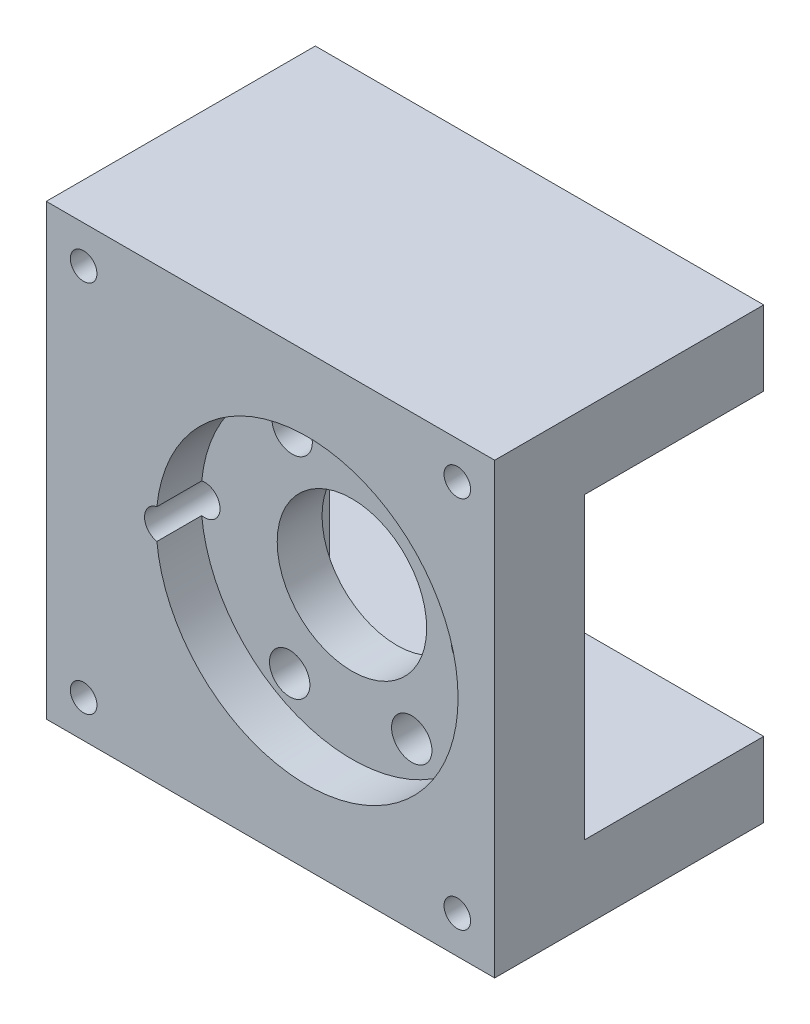
from build123d import *

# Parameters (mm, degrees)
SKETCH2_W              = 30
SKETCH2_H              = 30
SKETCH2_R              = 5
SKETCH2_R_2            = 1.025
BOSS_EXTRUDE1_DEPTH    = 18
SKETCH3_W              = 30
SKETCH3_H              = 20
CUT_EXTRUDE1_DEPTH     = 9
F_2_56_TAPPED_HOLE1_D  = 1.778
CUT_EXTRUDE2_START     = -3
SKETCH8_R              = 10.1
SKETCH8_R_2            = 5
SKETCH8_R_3            = 1.025
CUT_EXTRUDE2_DEPTH     = 3
BOSS_EXTRUDE2_START    = 0.4
SKETCH9_R              = 2
SKETCH9_R_2            = 1.025
BOSS_EXTRUDE2_DEPTH    = 0.4
SKETCH10_W             = 20.050000056
SKETCH10_H             = 20
CUT_EXTRUDE3_DEPTH     = 2.999999892
FILLET1_START          = 9
FILLET1_DEPTH          = 4
M2_5_CLEARANCE_HOLE1_D = 2.7


with BuildPart() as part:
    # Sketch2 → Boss-Extrude1 (new body)
    # profile 1 of 2: a face of its own
    with BuildSketch(Plane.XY):
        with Locations((15, 0)):
            Rectangle(SKETCH2_W, SKETCH2_H)
        with Locations((17.449999944, 0)):
            Circle(SKETCH2_R, mode=Mode.SUBTRACT)
        with Locations((7.599999986, 0)):
            Circle(SKETCH2_R_2, mode=Mode.SUBTRACT)
    # profile 2 of 2: a face of its own
    with BuildSketch(Plane.XY):
        with BuildLine():
            ThreePointArc((22.449999944, 0), (20.98553385, -3.535533906), (17.449999944, -5))
            Line((17.449999944, -5), (30, -5))
            Line((30, -5), (30, 5))
            Line((30, 5), (17.449999944, 5))
            ThreePointArc((17.449999944, 5), (20.98553385, 3.535533906), (22.449999944, 0))
        make_face()
    extrude(amount=BOSS_EXTRUDE1_DEPTH)

    # Sketch3 → Cut-Extrude1 (cut)
    with BuildSketch(Plane(origin=(0, 0, 0), x_dir=(-1, 0, 0), z_dir=(0, 0, -1))):
        with Locations((-15, 0)):
            Rectangle(SKETCH3_W, SKETCH3_H)
    extrude(amount=-CUT_EXTRUDE1_DEPTH, mode=Mode.SUBTRACT)

    # #2-56 Tapped Hole1 (through all)
    with Locations(Plane(origin=(0, 0, 0), x_dir=(-1, 0, 0), z_dir=(0, 0, -1))):
        with Locations((-27.5, 12.5), (-27.5, -12.5), (-2.5, -12.5), (-2.5, 12.5)):
            Hole(F_2_56_TAPPED_HOLE1_D / 2)

    # Sketch8 → Cut-Extrude2 (cut)
    # profile 1 of 2: a face of its own
    with BuildSketch(Plane.XY.offset(18).offset(CUT_EXTRUDE2_START)):
        with Locations((17.449999944, 0)):
            Circle(SKETCH8_R)
        with Locations(Location((17.449999944, 0, 0), (0, 0, 180))):
            Circle(SKETCH8_R_2, mode=Mode.SUBTRACT)
    # profile 2 of 2: a face of its own
    with BuildSketch(Plane.XY.offset(18).offset(CUT_EXTRUDE2_START)):
        with Locations(Location((7.599999986, 0, 0), (0, 0, 180))):
            Circle(SKETCH8_R_3)
    extrude(amount=CUT_EXTRUDE2_DEPTH, mode=Mode.SUBTRACT)

    # Sketch9 → Boss-Extrude2 (add)
    with BuildSketch(Plane(origin=(0, 0, 9), x_dir=(-1, 0, 0), z_dir=(0, 0, -1)).offset(BOSS_EXTRUDE2_START)):
        with Locations(Location((-7.599999986, 0, 0), (0, 0, 180))):
            Circle(SKETCH9_R)
        with Locations(Location((-7.599999986, 0, 0), (0, 0, 78.757190581))):
            Circle(SKETCH9_R_2, mode=Mode.SUBTRACT)
    extrude(amount=-BOSS_EXTRUDE2_DEPTH)

    # Sketch10 → Cut-Extrude3 (cut)
    with BuildSketch(Plane(origin=(0, 0, 9), x_dir=(-1, 0, 0), z_dir=(0, 0, -1))):
        with Locations((-19.974999972, 0)):
            Rectangle(SKETCH10_W, SKETCH10_H)
    extrude(amount=-CUT_EXTRUDE3_DEPTH, mode=Mode.SUBTRACT)

    # Fillet1: read off the stored shape, not the designer's step
    # Fillet1 outline → Fillet1 (add)
    with BuildSketch(Plane.XY.offset(FILLET1_START)):
        with BuildLine():
            Line((9.949999944, -10), (13.251999944, -10))
            ThreePointArc((13.251999944, -10), (10.917133353, -9.032866591), (9.949999944, -6.698))
            Line((9.949999944, -6.698), (9.949999944, -10))
        make_face()
        with BuildLine():
            Line((9.949999944, 10), (9.949999944, 6.698))
            ThreePointArc((9.949999944, 6.698), (10.917133353, 9.032866591), (13.251999944, 10))
            Line((13.251999944, 10), (9.949999944, 10))
        make_face()
    extrude(amount=FILLET1_DEPTH)

    # M2.5 Clearance Hole1 (through all)
    with Locations(Plane(origin=(0, 0, 11.999999892), x_dir=(-1, 0, 0), z_dir=(0, 0, -1))):
        with Locations((-21.449999944, 6.92820323), (-13.449999944, 6.92820323), (-13.285717643, -7.212748522), (-21.449999944, -6.92820323), (-25.449999944, 0)):
            Hole(M2_5_CLEARANCE_HOLE1_D / 2)


solid = part.part
